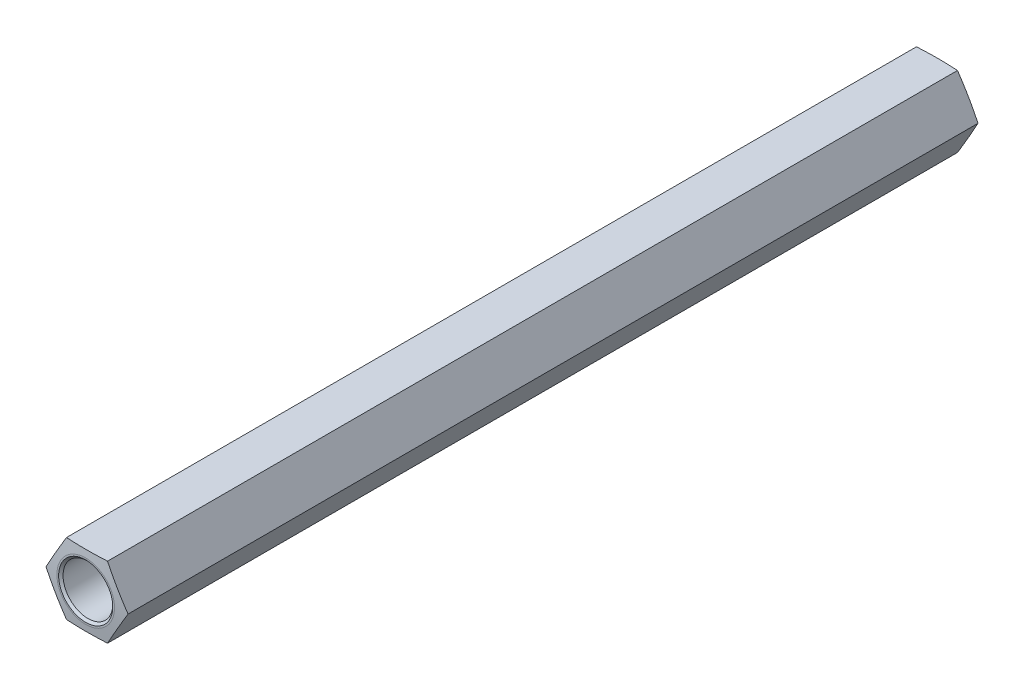
from build123d import *

# Parameters (mm, degrees)
SKETCH1_R      = 2.220000009
EXTRUDE1_DEPTH = 38.1
CHAMFER1_SIZE  = 0.2


with BuildPart() as part:
    # Sketch1 → Extrude1 (new, symmetric)
    with BuildSketch(Plane.XY):
        Polygon((-3.666174209, -6.3e-08), (-1.833087105, -3.175000063), (1.833087105, -3.174999937), (3.666174209, 6.3e-08), (1.833087105, 3.175000063), (-1.833087105, 3.174999937), align=None)
        with Locations((0, -6.3e-08)):
            Circle(SKETCH1_R, mode=Mode.SUBTRACT)
    extrude(amount=EXTRUDE1_DEPTH, both=True)

    # Chamfer1
    chamfer1_edges = [part.edges().sort_by_distance(p)[0] for p in [
        (-2.220000009, -6.3e-08, -38.1),
        (-2.220000009, -6.3e-08, 38.1),
    ]]
    chamfer(chamfer1_edges, length=CHAMFER1_SIZE)

    # Sketch2 → Cut-Revolve1 (revolve, cut)
    with BuildSketch(Plane.XZ):
        Polygon((-2.572739255, -38.1), (-3.666174209, -37.98), (-3.666174209, -38.1), align=None)
    cut_revolve1 = revolve(axis=Axis((0, -6.3e-08, 38.1), (0, 0, -1)), mode=Mode.SUBTRACT)

    # Mirror1: Cut-Revolve1 across plane
    add(cut_revolve1.mirror(Plane.XY), mode=Mode.SUBTRACT)


solid = part.part
